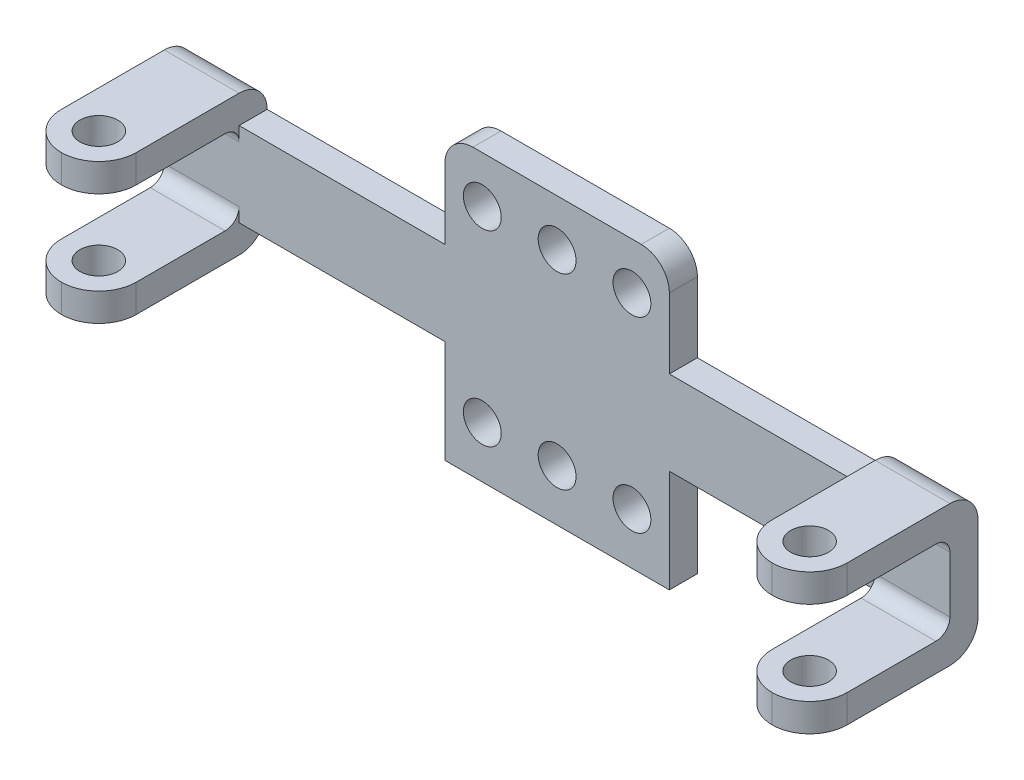
from build123d import *

# Parameters (mm, degrees)
SKETCH1_W                = 40
SKETCH1_H                = 60
BOSS_EXTRUDE1_DEPTH      = 3
BOSS_EXTRUDE3_DEPTH      = 10
BOSS_EXTRUDE3_DEPTH_BACK = 50
SKETCH4_R                = 2.025
CUT_EXTRUDE1_DEPTH       = 76.663729752
SKETCH5_W                = 10
SKETCH5_H                = 3
CUT_EXTRUDE3_DEPTH       = 5
FILLET5_R                = 3
FILLET6_R                = 1.5
SKETCH6_W                = 18
SKETCH6_H                = 30
CUT_EXTRUDE4_DEPTH       = 76.663729752
SKETCH7_W                = 30
SKETCH7_H                = 9
BOSS_EXTRUDE4_DEPTH      = 3
SKETCH8_W                = 8
SKETCH8_H                = 4.5
CUT_EXTRUDE5_DEPTH       = 62.26173357
BOSS_EXTRUDE5_DEPTH      = 15
BOSS_EXTRUDE5_DEPTH_BACK = 3
SKETCH9_W                = 8
SKETCH9_H                = 3
FILLET7_R                = 3
FILLET8_R                = 1.5
SKETCH10_R               = 2.025
CUT_EXTRUDE6_DEPTH       = 16
FILLET9_R                = 4
FILLET10_R               = 3
CUT_EXTRUDE7_DEPTH       = 82.172655494
CUT_EXTRUDE7_DEPTH_BACK  = 10


with BuildPart() as part:
    # Sketch1 → Boss-Extrude1 (new body)
    with BuildSketch(Plane(origin=(0, 0, 0), x_dir=(1, 0, 0), z_dir=(0, 1, 0))):
        Rectangle(SKETCH1_W, SKETCH1_H)
    extrude(amount=BOSS_EXTRUDE1_DEPTH)

    # Sketch3 → Boss-Extrude3 (add, two sides: drawn at the far end of the back side and taken through both)
    with BuildSketch(Plane.ZY.offset(20).offset(-BOSS_EXTRUDE3_DEPTH_BACK)):
        Polygon((-30, 3), (-30, 35), (-33, 35), (-33, 0), (-30, 0), align=None)
    extrude(amount=BOSS_EXTRUDE3_DEPTH + BOSS_EXTRUDE3_DEPTH_BACK)

    # Sketch4 → Cut-Extrude1 (cut, through all)
    with BuildSketch(Plane.XY.offset(-30)):
        with Locations((0, 30)):
            Circle(SKETCH4_R)
        with Locations((8, 30)):
            Circle(SKETCH4_R)
        with Locations((16, 30)):
            Circle(SKETCH4_R)
        with Locations((-8, 30)):
            Circle(SKETCH4_R)
        with Locations((-16, 30)):
            Circle(SKETCH4_R)
        with Locations((-16, 10)):
            Circle(SKETCH4_R)
        with Locations((-8, 10)):
            Circle(SKETCH4_R)
        with Locations((0, 10)):
            Circle(SKETCH4_R)
        with Locations((8, 10)):
            Circle(SKETCH4_R)
        with Locations((16, 10)):
            Circle(SKETCH4_R)
    extrude(amount=-CUT_EXTRUDE1_DEPTH, mode=Mode.SUBTRACT)

    # Sketch5 → Cut-Extrude3 (cut)
    with BuildSketch(Plane.XZ):
        with Locations((-25, -31.5)):
            Rectangle(SKETCH5_W, SKETCH5_H)
        with Locations((25, -31.5)):
            Rectangle(SKETCH5_W, SKETCH5_H)
    extrude(amount=-CUT_EXTRUDE3_DEPTH, mode=Mode.SUBTRACT)

    # Fillet5
    fillet5_edges = [part.edges().sort_by_distance(p)[0] for p in [
        (0, 0, -33),
    ]]
    fillet(fillet5_edges, radius=FILLET5_R)

    # Fillet6
    fillet6_edges = [part.edges().sort_by_distance(p)[0] for p in [
        (0, 3, -30),
    ]]
    fillet(fillet6_edges, radius=FILLET6_R)

    # Sketch6 → Cut-Extrude4 (cut, through all)
    with BuildSketch(Plane.XY.offset(-30)):
        with Locations((-21, 20)):
            Rectangle(SKETCH6_W, SKETCH6_H)
        with Locations((21, 20)):
            Rectangle(SKETCH6_W, SKETCH6_H)
    extrude(amount=-CUT_EXTRUDE4_DEPTH, mode=Mode.SUBTRACT)

    # Sketch7 → Boss-Extrude4 (add)
    with BuildSketch(Plane.XY.offset(-30)):
        with Locations((-27, 20)):
            Rectangle(SKETCH7_W, SKETCH7_H)
        with Locations((27, 20)):
            Rectangle(SKETCH7_W, SKETCH7_H)
    extrude(amount=-BOSS_EXTRUDE4_DEPTH)

    # Sketch8 → Cut-Extrude5 (cut, through all)
    with BuildSketch(Plane(origin=(0, 5, 0), x_dir=(1, 0, 0), z_dir=(0, 1, 0))):
        with Locations((-16, 30.75)):
            Rectangle(SKETCH8_W, SKETCH8_H)
        with Locations((16, 30.75)):
            Rectangle(SKETCH8_W, SKETCH8_H)
    extrude(amount=-CUT_EXTRUDE5_DEPTH, mode=Mode.SUBTRACT)

    # Sketch9 → Boss-Extrude5 (add, two sides: drawn at the far end of the back side and taken through both)
    with BuildSketch(Plane.XY.offset(-30).offset(-BOSS_EXTRUDE5_DEPTH_BACK)):
        with Locations((-38, 26)):
            Rectangle(SKETCH9_W, SKETCH9_H)
        with Locations((-38, 14)):
            Rectangle(SKETCH9_W, SKETCH9_H)
        with Locations((38, 14)):
            Rectangle(SKETCH9_W, SKETCH9_H)
        with Locations((38, 26)):
            Rectangle(SKETCH9_W, SKETCH9_H)
    extrude(amount=BOSS_EXTRUDE5_DEPTH + BOSS_EXTRUDE5_DEPTH_BACK)

    # Fillet7
    fillet7_edges = [part.edges().sort_by_distance(p)[0] for p in [
        (38, 12.5, -33),
        (-38, 12.5, -33),
        (38, 27.5, -33),
        (-38, 27.5, -33),
    ]]
    fillet(fillet7_edges, radius=FILLET7_R)

    # Fillet8
    fillet8_edges = [part.edges().sort_by_distance(p)[0] for p in [
        (-38, 15.5, -30),
        (38, 24.5, -30),
        (-38, 24.5, -30),
        (38, 15.5, -30),
    ]]
    fillet(fillet8_edges, radius=FILLET8_R)

    # Sketch10 → Cut-Extrude6 (cut)
    with BuildSketch(Plane(origin=(0, 27.5, 0), x_dir=(1, 0, 0), z_dir=(0, 1, 0))):
        with Locations(Location((-38, 19, 0), (0, 0, 270))):
            Circle(SKETCH10_R)
        with Locations(Location((38, 19, 0), (0, 0, 180))):
            Circle(SKETCH10_R)
    extrude(amount=-CUT_EXTRUDE6_DEPTH, mode=Mode.SUBTRACT)

    # Fillet9
    fillet9_edges = [part.edges().sort_by_distance(p)[0] for p in [
        (42, 14, -15),
        (42, 26, -15),
        (-34, 14, -15),
        (-34, 26, -15),
        (34, 14, -15),
        (34, 26, -15),
        (-42, 14, -15),
        (-42, 26, -15),
    ]]
    fillet(fillet9_edges, radius=FILLET9_R - 0.0001)  # a hair under: the kernel refuses the full size

    # Fillet10
    fillet10_edges = [part.edges().sort_by_distance(p)[0] for p in [
        (-12, 35, -31.5),
        (12, 35, -31.5),
        (-20, 1.5, -28.5),
        (20, 1.5, -28.5),
        (20, 1.5, 30),
        (-20, 1.5, 30),
    ]]
    fillet(fillet10_edges, radius=FILLET10_R)

    # Sketch11 → Cut-Extrude7 (cut, two sides: drawn at the far end of the back side and taken through both)
    with BuildSketch(Plane.XY.offset(-30).offset(-CUT_EXTRUDE7_DEPTH_BACK)):
        Polygon((-12, 4.5), (-24.843413812, 4.5), (-24.843413812, -2.532189306), (23.385466992, -2.532189306), (23.385466992, 4.5), align=None)
    extrude(amount=CUT_EXTRUDE7_DEPTH + CUT_EXTRUDE7_DEPTH_BACK, mode=Mode.SUBTRACT)


solid = part.part
